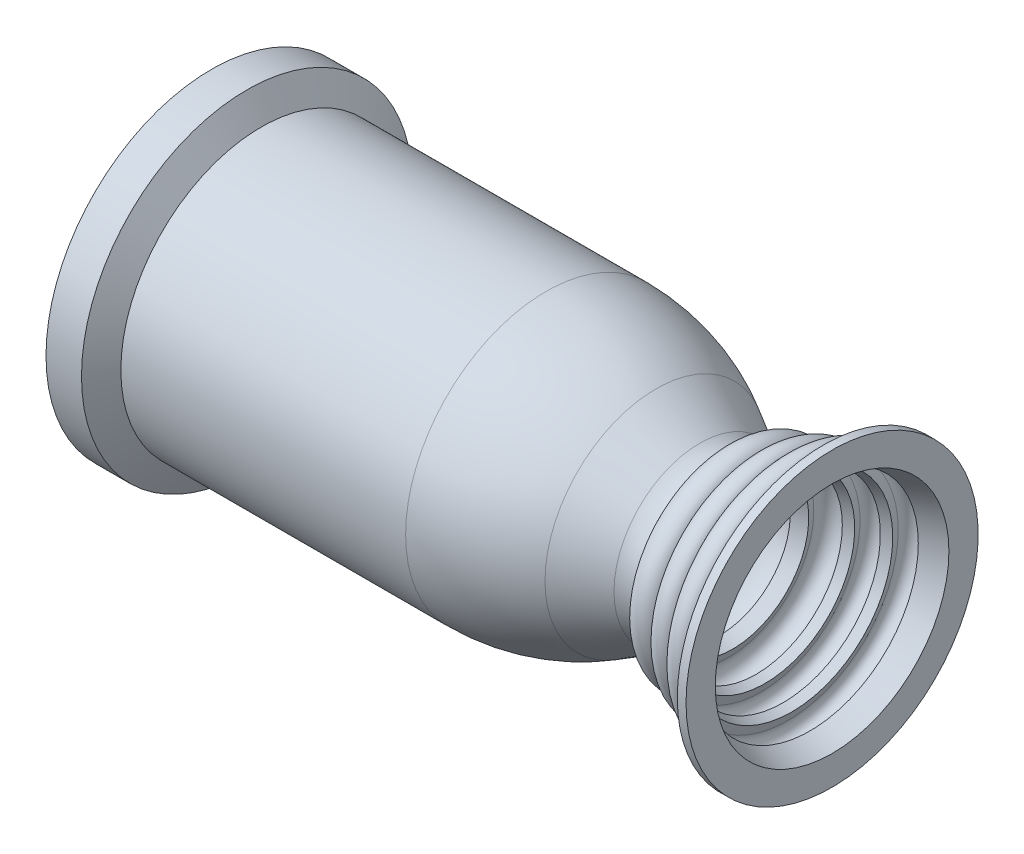
from build123d import *

# Parameters (mm, degrees)
CUT_EXTRUDE4_DEPTH      = 389.908050082
CUT_EXTRUDE4_DEPTH_BACK = 389.908050082
SKETCH17_W              = 85
SKETCH17_H              = 190


with BuildPart() as part:
    # Sketch3 → Revolve1 (revolve)
    with BuildSketch(Plane.XY):
        with BuildLine():
            Line((0, 71.5011717), (144.934666475, 71.5011717))
            ThreePointArc((144.934666475, 71.5011717), (173.892574508, 67.688769671), (200.877042723, 56.51141211))
            Line((200.877042723, 56.51141211), (223.127154881, 43.665279514))
            ThreePointArc((223.127154881, 43.665279514), (227.625034583, 41.721337074), (232.448772375, 40.860298318))
            add(Edge.make_bspline(
                [(232.448772375, 40.860298318), (234.86856203, 41.933657894), (240.173238318, 44.266655644), (251.176182965, 49.013937562), (265.440009786, 54.97345202), (282.448229164, 61.765962568), (299.354503113, 68.202057856), (316.156963457, 74.280596731), (332.857651733, 80.001884245), (346.685594207, 84.470267584), (357.704525634, 87.868146407), (363.182392167, 89.503083437), (365.9308663, 90.309661005)],
                knots=[0.492875979, 0.492875979, 0.492875979, 0.492875979, 0.492966882, 0.493074775, 0.493290561, 0.493506346, 0.493722132, 0.493937918, 0.494153704, 0.494369489, 0.494477382, 0.494585275, 0.494585275, 0.494585275, 0.494585275], degree=3))
            Line((365.9308663, 90.309661005), (367.338810321, 85.511985147))
            add(Edge.make_bspline(
                [(233.424633311, 35.822756061), (236.183141196, 37.049408729), (241.820242455, 39.531718175), (253.12775411, 44.410404122), (267.331680592, 50.344882311), (284.265598042, 57.10770533), (301.095145103, 63.51457761), (317.818383555, 69.564442688), (334.43732724, 75.257710839), (348.19495997, 79.703362784), (359.156425704, 83.083517043), (364.604957844, 84.709698506), (367.338810321, 85.511985147)],
                knots=[0.492862754, 0.492862754, 0.492862754, 0.492862754, 0.492966882, 0.493074775, 0.493290561, 0.493506346, 0.493722132, 0.493937918, 0.494153704, 0.494369489, 0.494477382, 0.494585275, 0.494585275, 0.494585275, 0.494585275], degree=3))
            ThreePointArc((233.424633311, 35.822756061), (226.800103593, 36.756276843), (220.627157517, 39.335150973))
            Line((220.627157517, 39.335150973), (198.377039169, 52.181287144))
            ThreePointArc((198.377039169, 52.181287144), (172.598474463, 62.859141831), (144.9346606, 66.5011717))
            Line((144.9346606, 66.5011717), (0, 66.5011717))
            Line((0, 66.5011717), (0, 71.5011717))
        make_face()
    revolve(axis=Axis((0, 0, 0), (1, 0, 0)))

    # Sketch4 → Revolve5 (revolve)
    with BuildSketch(Plane.XY):
        Polygon((-25.4, 66.5011717), (-25.4, 84.2011717), (-7.332348419, 84.2011717), (0, 71.5011717), (0, 66.5011717), align=None)
    revolve(axis=Axis((0, 0, 0), (1, 0, 0)))

    # Sketch17 → Cut-Extrude4 (cut, two sides: drawn at the far end of the back side and taken through both)
    with BuildSketch(Plane.XY.offset(-CUT_EXTRUDE4_DEPTH_BACK)):
        with Locations((332.986, 0)):
            Rectangle(SKETCH17_W, SKETCH17_H)
    extrude(amount=CUT_EXTRUDE4_DEPTH + CUT_EXTRUDE4_DEPTH_BACK, mode=Mode.SUBTRACT)

    # Sketch18 → Revolve7 (revolve)
    with BuildSketch(Plane.XY):
        with BuildLine():
            Line((290.486, 64.812548202), (290.486, 74.344558602))
            Line((290.486, 74.344558602), (286.041, 74.344558602))
            Line((286.041, 74.344558602), (286.041, 63.107390563))
            add(Edge.make_bspline(
                [(290.486, 64.812548202), (289.005513956, 64.248266071), (287.523845347, 63.679879019), (286.041, 63.107390563)],
                knots=[0.493835272, 0.493835272, 0.493835272, 0.493835272, 0.493891953, 0.493891953, 0.493891953, 0.493891953], degree=3))
        make_face()
    revolve(axis=Axis((0, 0, 0), (1, 0, 0)))

    # Sketch13 → Revolve6 (revolve)
    with BuildSketch(Plane.XY):
        with BuildLine():
            Line((253.452894778, 49.926348503), (264.534326054, 54.53089852))
            ThreePointArc((264.534326054, 54.53089852), (256.691335407, 57.76933915), (253.452894778, 49.926348503))
        make_face()
        with BuildLine():
            Line((237.023320854, 42.878591235), (250.795528896, 48.822161344))
            ThreePointArc((250.795528896, 48.822161344), (240.940832573, 52.729082189), (237.023320854, 42.878591235))
        make_face()
        with BuildLine():
            Line((267.198650557, 55.637915731), (278.337884608, 60.100704118))
            ThreePointArc((278.337884608, 60.100704118), (270.531031028, 63.453509633), (267.198650557, 55.637915731))
        make_face()
    revolve(axis=Axis((0, 0, 0), (1, 0, 0)))

    # Sketch19 → Cut-Revolve1 (revolve, cut)
    with BuildSketch(Plane.XY):
        with BuildLine():
            Line((237.945873974, 43.276730671), (239.927065155, 38.685992005))
            Line((239.927065155, 38.685992005), (251.858568202, 43.835182654))
            Line((251.858568202, 43.835182654), (249.877377021, 48.42592132))
            ThreePointArc((249.877377021, 48.42592132), (241.337030173, 51.817077519), (237.945873974, 43.276730671))
        make_face()
        with BuildLine():
            Line((254.369462652, 50.326700303), (256.288085496, 45.709462343))
            Line((256.288085496, 45.709462343), (265.522511147, 49.546687142))
            Line((265.522511147, 49.546687142), (263.603888303, 54.163925102))
            ThreePointArc((263.603888303, 54.163925102), (257.068063078, 56.862525528), (254.369462652, 50.326700303))
        make_face()
        with BuildLine():
            Line((268.126923235, 56.009816035), (270.150419973, 50.95911638))
            Line((270.150419973, 50.95911638), (279.433108668, 54.67810416))
            Line((279.433108668, 54.67810416), (277.40961193, 59.728803815))
            ThreePointArc((277.40961193, 59.728803815), (270.908773693, 62.510654272), (268.126923235, 56.009816035))
        make_face()
    revolve(axis=Axis((0, 0, 0), (1, 0, 0)), mode=Mode.SUBTRACT)


solid = part.part
